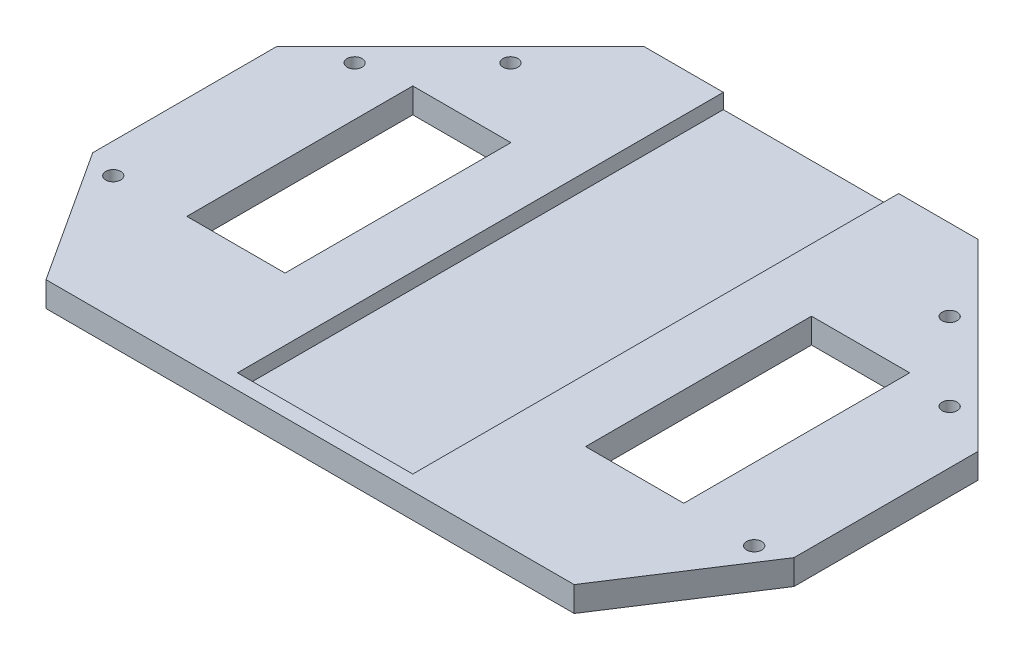
from build123d import *

# Parameters (mm, degrees)
SKETCH1_R           = 1.5
SKETCH1_W           = 19.6
SKETCH1_H           = 45.1
BOSS_EXTRUDE1_DEPTH = 5
SKETCH2_W           = 35
SKETCH2_H           = 97
CUT_EXTRUDE1_DEPTH  = 3


with BuildPart() as part:
    # Sketch1 → Boss-Extrude1 (new body)
    with BuildSketch(Plane(origin=(0, 0, 0), x_dir=(1, 0, 0), z_dir=(0, 1, 0))):
        Polygon((-52.719673599, -40), (-70, -13.390630812), (-70, 23.338095117), (-33.338095117, 60), (0, 60), (0, -40), align=None)
        with Locations((-43.840620434, 43.840620434)):
            Circle(SKETCH1_R, mode=Mode.SUBTRACT)
        with Locations((-59.39696962, 28.284271247)):
            Circle(SKETCH1_R, mode=Mode.SUBTRACT)
        with Locations((-63.979633983, -15.316867676)):
            Circle(SKETCH1_R, mode=Mode.SUBTRACT)
        with Locations((-39.8, 7.55)):
            Rectangle(SKETCH1_W, SKETCH1_H, mode=Mode.SUBTRACT)
    boss_extrude1 = extrude(amount=BOSS_EXTRUDE1_DEPTH)

    # Mirror1: Boss-Extrude1 across plane
    add(boss_extrude1.mirror(Plane(origin=(0, 5, 40), x_dir=(0, 0, 1), z_dir=(-1, 0, 0))))

    # Sketch2 → Cut-Extrude1 (cut)
    with BuildSketch(Plane(origin=(0, 5, 0), x_dir=(1, 0, 0), z_dir=(0, 1, 0))):
        with Locations((0, 11.5)):
            Rectangle(SKETCH2_W, SKETCH2_H)
    extrude(amount=-CUT_EXTRUDE1_DEPTH, mode=Mode.SUBTRACT)


solid = part.part
